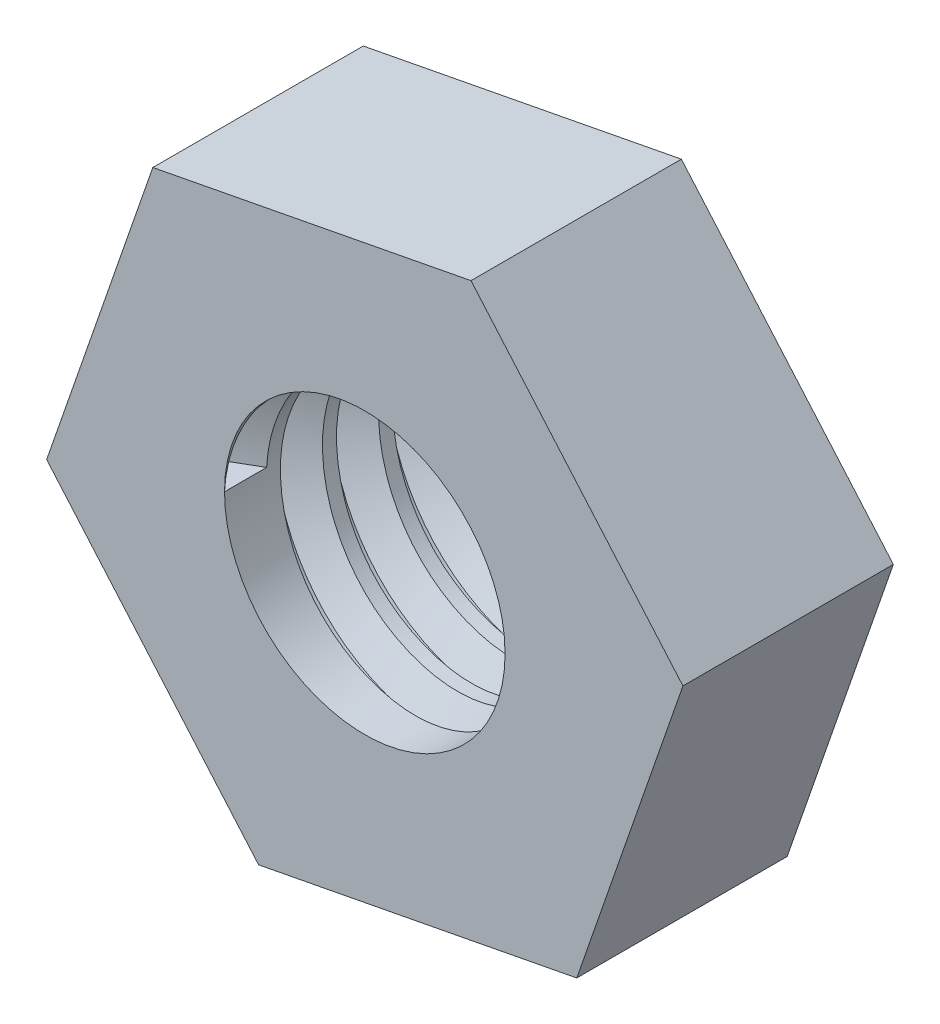
from build123d import *

# Parameters (mm, degrees)
BOSS_EXTRUDE1_DEPTH = 1.5
SKETCH2_R           = 1
CUT_EXTRUDE1_DEPTH  = 4.486277461
THREAD1_PITCH       = 0.4


with BuildPart() as part:
    # Sketch1 → Boss-Extrude1 (new body)
    with BuildSketch(Plane.XY):
        Polygon((1.511025245, -1.746463868), (2.267994699, 0.435354314), (0.756969454, 2.181818182), (-1.511025245, 1.746463868), (-2.267994699, -0.435354314), (-0.756969454, -2.181818182), align=None)
    extrude(amount=BOSS_EXTRUDE1_DEPTH)

    # Sketch2 → Cut-Extrude1 (cut, through all)
    with BuildSketch(Plane.XY.offset(1.5)):
        Circle(SKETCH2_R)
    extrude(amount=-CUT_EXTRUDE1_DEPTH, mode=Mode.SUBTRACT)

    # Thread1: the profile of Thread Profile1 profile screwed along a right-hand helix of 3.75 turns, 6 arcs to a turn; built about Z, then put on its axis
    thread1_z = Axis((0, 0, 0), (0, 0, 1))
    thread1_corners = [(0.9997, 0, -0.000173205), (1.21650635, 0, 0.124999999), (1.21650635, 0, 0.174999999), (0.9997, 0, 0.300173204)]
    with BuildLine(mode=Mode.PRIVATE) as thread1_profile:
        Line(thread1_corners[0], thread1_corners[1])
        Line(thread1_corners[1], thread1_corners[2])
        Line(thread1_corners[2], thread1_corners[3])
        Line(thread1_corners[3], thread1_corners[0])
    thread1_cap = Face(thread1_profile.wire())
    thread1_turn_angles = [0, 30, 60, 90, 120, 150, 180, 210, 240, 270, 300, 330, 360]
    thread1_turn_weights = [1, 0.8660254037844387, 1, 0.8660254037844387, 1, 0.8660254037844387, 1, 0.8660254037844387, 1, 0.8660254037844387, 1, 0.8660254037844387, 1]
    thread1_turn_rails = [Edge.make_bspline([Vector(p[0], p[1], 0).rotate(thread1_z, thread1_turn_angles[k]) / thread1_turn_weights[k] + Vector(0, 0, p[2] + THREAD1_PITCH * thread1_turn_angles[k] / 360) for k in range(13)], [0, 0, 0, 1, 1, 2, 2, 3, 3, 4, 4, 5, 5, 6, 6, 6], 2, thread1_turn_weights) for p in thread1_corners]
    thread1_turn_sides = [Face.make_surface_from_curves(thread1_turn_rails[p[0]], thread1_turn_rails[p[1]]) for p in [(0, 1), (1, 2), (2, 3), (3, 0)]]
    thread1_last_angles = [1080, 1110, 1140, 1170, 1200, 1230, 1260, 1290, 1320, 1335, 1350]
    thread1_last_weights = [1, 0.8660254037844387, 1, 0.8660254037844387, 1, 0.8660254037844387, 1, 0.8660254037844387, 1, 0.9659258262890683, 1]
    thread1_last_rails = [Edge.make_bspline([Vector(p[0], p[1], 0).rotate(thread1_z, thread1_last_angles[k]) / thread1_last_weights[k] + Vector(0, 0, p[2] + THREAD1_PITCH * thread1_last_angles[k] / 360) for k in range(11)], [0, 0, 0, 1, 1, 2, 2, 3, 3, 4, 4, 5, 5, 5], 2, thread1_last_weights) for p in thread1_corners]
    thread1_last_sides = [Face.make_surface_from_curves(thread1_last_rails[p[0]], thread1_last_rails[p[1]]) for p in [(0, 1), (1, 2), (2, 3), (3, 0)]]
    thread1 = Plane(origin=(0, 0, 1.5), x_dir=(-1, 0, 0), z_dir=(0, 0, -1)) * Solid(Shell([*[p.moved(Location((0, 0, THREAD1_PITCH * i))) for i in range(3) for p in thread1_turn_sides], *thread1_last_sides, thread1_cap, thread1_cap.rotate(thread1_z, 1350).moved(Location((0, 0, THREAD1_PITCH * 1350 / 360)))]))
    add(thread1, mode=Mode.SUBTRACT)


solid = part.part
